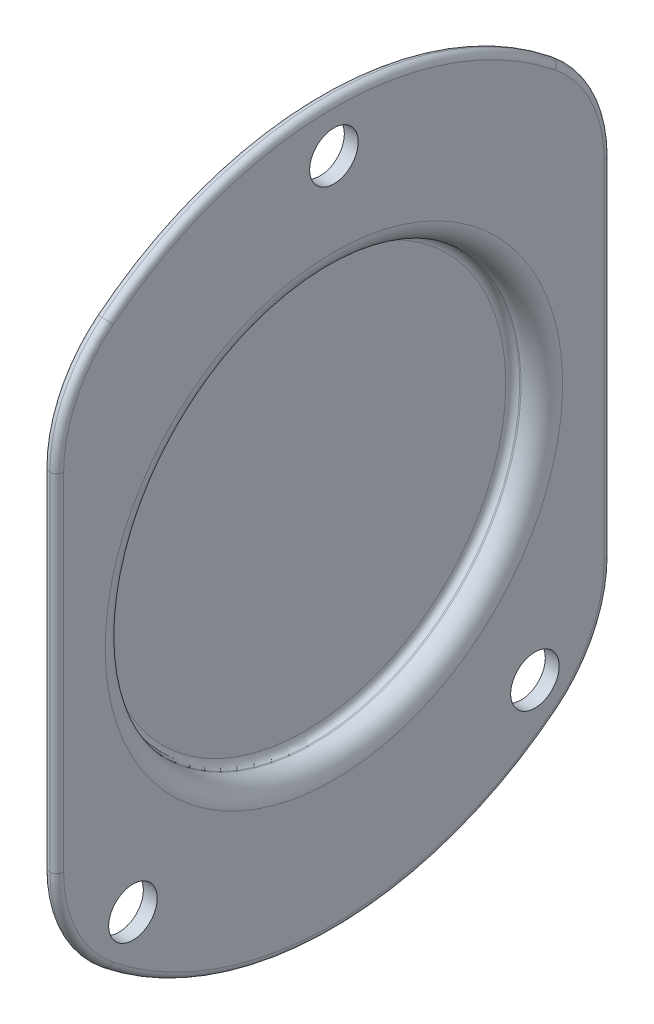
from build123d import *

# Parameters (mm, degrees)
SKETCH2_OUTSIDE_W   = 135.442
SKETCH2_OUTSIDE_H   = 135.442
SKETCH2_OUTSIDE_W_2 = 80
SKETCH2_OUTSIDE_H_2 = 104
CUT_EXTRUDE1_DEPTH  = 74.8
SKETCH3_R           = 3.5
CUT_EXTRUDE2_DEPTH  = 10
FILLET1_R           = 20
FILLET2_R           = 1


with BuildPart() as part:
    # Sketch1 → Revolve1 (revolve)
    with BuildSketch(Plane.XY, mode=Mode.PRIVATE) as revolve1_sk:
        with BuildLine():
            Line((0, 0), (0, 29))
            ThreePointArc((0, 29), (0.292893219, 29.707106781), (1, 30))
            Line((1, 30), (1.2, 30))
            ThreePointArc((1.2, 30), (3.321320344, 30.878679656), (4.2, 33))
            Line((4.2, 33), (4.2, 52))
            Line((4.2, 52), (2.2, 52))
            Line((2.2, 52), (2.2, 33))
            ThreePointArc((2.2, 33), (1.907106781, 32.292893219), (1.2, 32))
            Line((1.2, 32), (1, 32))
            ThreePointArc((1, 32), (-1.121320344, 31.121320344), (-2, 29))
            Line((-2, 29), (-2, 0))
            Line((-2, 0), (0, 0))
        make_face()
    revolve(revolve1_sk.sketch.rotate(Axis((-2, 0, 0), (1, 0, 0)), 90), axis=Axis((-2, 0, 0), (1, 0, 0)))

    # Sketch2 outside → Cut-Extrude1 (cut, through all)
    with BuildSketch(Plane(origin=(4.2, 0, 0), x_dir=(0, 0, -1), z_dir=(1, 0, 0))):
        Rectangle(SKETCH2_OUTSIDE_W, SKETCH2_OUTSIDE_H)
        Rectangle(SKETCH2_OUTSIDE_W_2, SKETCH2_OUTSIDE_H_2, mode=Mode.SUBTRACT)
    extrude(amount=-CUT_EXTRUDE1_DEPTH, mode=Mode.SUBTRACT)

    # Sketch3 → Cut-Extrude2 (cut)
    with BuildSketch(Plane(origin=(4.2, 0, 0), x_dir=(0, 0, -1), z_dir=(1, 0, 0))):
        with Locations((0, 45)):
            Circle(SKETCH3_R)
        with Locations((-29, -35)):
            Circle(SKETCH3_R)
        with Locations((29, -35)):
            Circle(SKETCH3_R)
    extrude(amount=-CUT_EXTRUDE2_DEPTH, mode=Mode.SUBTRACT)

    # Fillet1
    fillet1_edges = [part.edges().sort_by_distance(p)[0] for p in [
        (3.2, 33.226495452, 40),
        (3.2, -33.226495452, 40),
        (3.2, -33.226495452, -40),
        (3.2, 33.226495452, -40),
    ]]
    fillet(fillet1_edges, radius=FILLET1_R)

    # Fillet2
    fillet2_edges = [part.edges().sort_by_distance(p)[0] for p in [
        (2.2, 33.640246031, 38.027756377),
        (2.2, 0, 40),
        (2.2, -33.640246031, 38.027756377),
        (2.2, -52, 0),
        (2.2, -33.640246031, -38.027756377),
        (2.2, 0, -40),
        (2.2, 33.640246031, -38.027756377),
        (4.2, 33.640246031, 38.027756377),
        (4.2, 0, 40),
        (4.2, -33.640246031, 38.027756377),
        (4.2, -52, 0),
        (4.2, -33.640246031, -38.027756377),
        (4.2, 0, -40),
        (4.2, 33.640246031, -38.027756377),
        (2.2, 52, 0),
        (4.2, 52, 0),
    ]]
    fillet(fillet2_edges, radius=FILLET2_R - 0.0001)  # a hair under: the kernel refuses the full size


solid = part.part
